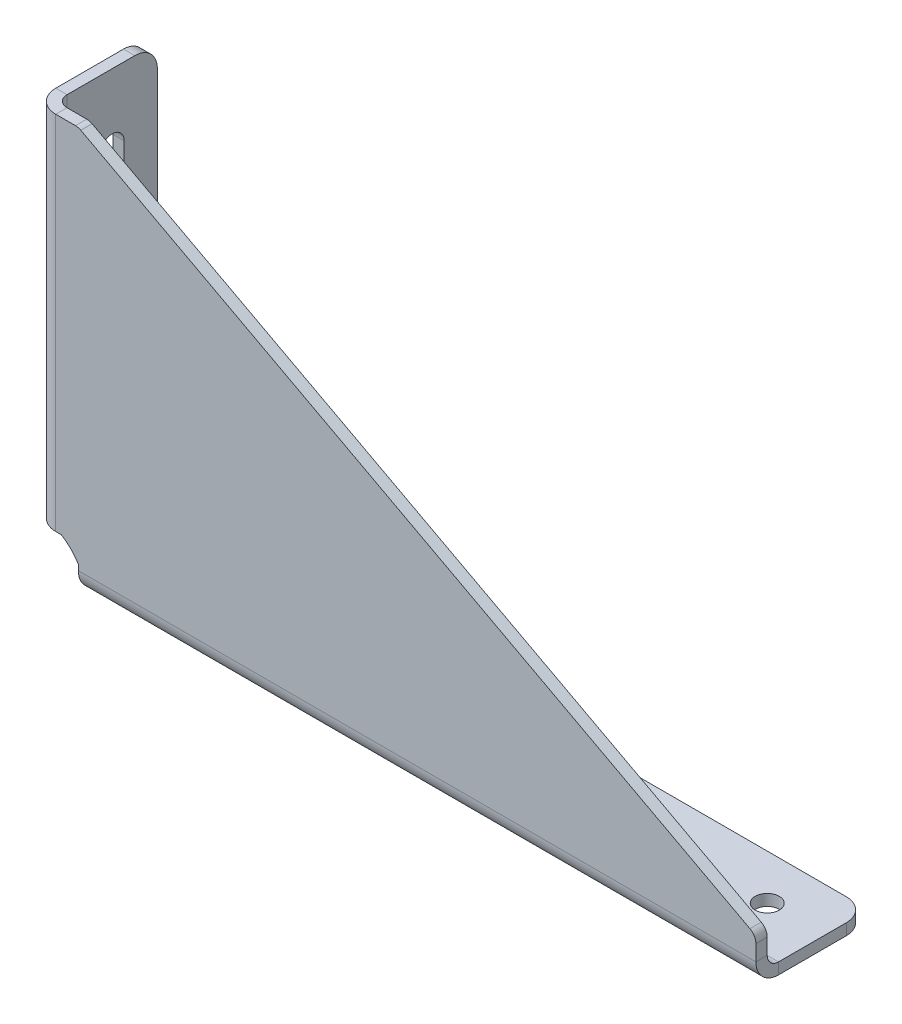
from build123d import *

# Parameters (mm, degrees)
BASE_FLANGE1_DEPTH                = 3.175
EDGE_FLANGE2_STRIP_W              = 19.05
EDGE_FLANGE2_STRIP_H              = 3.175
EDGE_FLANGE2_STRIP_CUT_DEPTH      = 190.5
EDGE_FLANGE2_RELIEF_W             = 20.6375
EDGE_FLANGE2_RELIEF_H             = 1.5875
EDGE_FLANGE2_RELIEF_CUT_DEPTH     = 3.175
EDGE_FLANGE2_STRIP_2_W            = 19.05
EDGE_FLANGE2_STRIP_2_H            = 3.175
EDGE_FLANGE2_STRIP_CUT_2_DEPTH    = 101.6
EDGE_FLANGE2_RELIEF_2_W           = 20.6375
EDGE_FLANGE2_RELIEF_2_H           = 1.5875
EDGE_FLANGE2_RELIEF_CUT_2_DEPTH   = 3.175
EDGE_FLANGE2_DEPTH                = 190.5
EDGE_FLANGE2_BEND_DEPTH           = 101.6
F_1_4_CLEARANCE_HOLE1_D           = 6.7564
F_1_4_CLEARANCE_HOLE1_ON_FACE_2_D = 6.7564
CUT_EXTRUDE1_DEPTH                = 235.885633075
FILLET1_R                         = 3.175
FILLET2_R                         = 6.35
F_1_4_START                       = -1
F_1_4_CLEARANCE_SLOT1_DEPTH       = 5
BODY_MOVE_COPY1_OUTLINE_R         = 3.3782
BODY_MOVE_COPY1_DEPTH             = 203.2
BODY_MOVE_COPY1_START             = 12.7
BODY_MOVE_COPY1_2_DEPTH           = 190.5
BODY_MOVE_COPY1_3_OUTLINE_R       = 3.3782
BODY_MOVE_COPY1_3_DEPTH           = 3.175
BODY_MOVE_COPY1_START_2           = 3.175
BODY_MOVE_COPY1_4_OUTLINE_W       = 101.6
BODY_MOVE_COPY1_4_OUTLINE_H       = 6.35
BODY_MOVE_COPY1_4_DEPTH           = 9.525
BODY_MOVE_COPY1_START_3           = 7.9375
BODY_MOVE_COPY1_5_DEPTH           = 4.7625
BODY_MOVE_COPY1_START_4           = 6.35
BODY_MOVE_COPY1_6_DEPTH           = 107.95
BODY_MOVE_COPY1_7_OUTLINE_W       = 4.7625
BODY_MOVE_COPY1_7_OUTLINE_H       = 6.35
BODY_MOVE_COPY1_7_OUTLINE_R       = 3.3782
BODY_MOVE_COPY1_7_DEPTH           = 7.9375
BODY_MOVE_COPY1_8_DEPTH           = 3.175
BODY_MOVE_COPY1_START_5           = -1
BODY_MOVE_COPY1_9_DEPTH           = 7.35
BODY_MOVE_COPY1_10_DEPTH          = 190.5


with BuildPart() as part:
    # Base-Flange1: sheet metal written as solids
    # Sketch3 → Base-Flange1 (new body)
    with BuildSketch(Plane.XY):
        with BuildLine():
            Line((0, 12.7), (0, 114.3))
            Line((0, 114.3), (12.7, 114.3))
            Line((12.7, 114.3), (203.2, 12.7))
            Line((203.2, 12.7), (203.2, 0))
            Line((203.2, 0), (12.7, 0))
            ThreePointArc((12.7, 0), (8.980256121, 8.980256121), (0, 12.7))
        make_face()
    extrude(amount=-BASE_FLANGE1_DEPTH)

    # Edge-Flange2: sheet metal written as solids
    # Edge-Flange2 strip (on a plane across the edge) → Edge-Flange2 strip cut (cut)
    with BuildSketch(Plane.YZ.offset(12.7)):
        with Locations((-3.175, -1.5875)):
            Rectangle(EDGE_FLANGE2_STRIP_W, EDGE_FLANGE2_STRIP_H)
    extrude(amount=EDGE_FLANGE2_STRIP_CUT_DEPTH, mode=Mode.SUBTRACT)

    # Edge-Flange2 relief (on the sheet) → Edge-Flange2 relief cut (cut)
    with BuildSketch(Plane(origin=(12.7, 6.35, 0), x_dir=(0, 1, 0), z_dir=(0, 0, 1))):
        with Locations((-8.73125, 0.79375)):
            Rectangle(EDGE_FLANGE2_RELIEF_W, EDGE_FLANGE2_RELIEF_H)
    extrude(amount=-EDGE_FLANGE2_RELIEF_CUT_DEPTH, mode=Mode.SUBTRACT)

    # Edge-Flange2 strip 2 (on a plane across the edge) → Edge-Flange2 strip cut 2 (cut)
    with BuildSketch(Plane.XZ.offset(-114.3)):
        with Locations((-3.175, -1.5875)):
            Rectangle(EDGE_FLANGE2_STRIP_2_W, EDGE_FLANGE2_STRIP_2_H)
    extrude(amount=EDGE_FLANGE2_STRIP_CUT_2_DEPTH, mode=Mode.SUBTRACT)

    # Edge-Flange2 relief 2 (on the sheet) → Edge-Flange2 relief cut 2 (cut)
    with BuildSketch(Plane(origin=(6.35, 114.3, 0), x_dir=(1, 0, 0), z_dir=(0, 0, 1))):
        with Locations((-8.73125, -102.39375)):
            Rectangle(EDGE_FLANGE2_RELIEF_2_W, EDGE_FLANGE2_RELIEF_2_H)
    extrude(amount=-EDGE_FLANGE2_RELIEF_CUT_2_DEPTH, mode=Mode.SUBTRACT)

    # Edge-Flange2 section (on a plane across the edge) → Edge-Flange2 (add)
    with BuildSketch(Plane.YZ.offset(12.7)):
        with BuildLine():
            Line((0, 3.175), (0, 28.575))
            Line((0, 28.575), (3.175, 28.575))
            Line((3.175, 28.575), (3.175, 3.175))
            ThreePointArc((3.175, 3.175), (4.10493597, 0.92993597), (6.35, 0))
            Line((6.35, 0), (6.35, -3.175))
            ThreePointArc((6.35, -3.175), (1.859871939, -1.315128061), (0, 3.175))
        make_face()
    extrude(amount=EDGE_FLANGE2_DEPTH)

    # Edge-Flange2 section 2 (on a plane across the edge) → Edge-Flange2 bend (add)
    with BuildSketch(Plane.XZ.offset(-114.3)):
        with BuildLine():
            Line((0, 3.175), (0, 28.575))
            Line((0, 28.575), (3.175, 28.575))
            Line((3.175, 28.575), (3.175, 3.175))
            ThreePointArc((3.175, 3.175), (4.10493597, 0.92993597), (6.35, 0))
            Line((6.35, 0), (6.35, -3.175))
            ThreePointArc((6.35, -3.175), (1.859871939, -1.315128061), (0, 3.175))
        make_face()
    extrude(amount=EDGE_FLANGE2_BEND_DEPTH)

    # 1/4 Clearance Hole1 (through all)
    with Locations(Plane(origin=(3.175, 28.575, 15.875), x_dir=(0, 0, 1), z_dir=(1, 0, 0))):
        with Locations((0, 0), (0, -63.5)):
            Hole(F_1_4_CLEARANCE_HOLE1_D / 2)

    # 1/4 Clearance Hole1 on face 2 (through all)
    with Locations(Plane(origin=(28.575, 3.175, 15.875), x_dir=(0, 0, 1), z_dir=(0, 1, 0))):
        with Locations((0, 0), (0, 158.75)):
            Hole(F_1_4_CLEARANCE_HOLE1_ON_FACE_2_D / 2)

    # Sketch27 → Cut-Extrude1 (cut, through all)
    with BuildSketch(Plane.XY):
        with BuildLine():
            Line((7.9375, 12.7), (0, 12.7))
            Line((0, 12.7), (0, 0))
            Line((0, 0), (12.7, 0))
            Line((12.7, 0), (12.7, 7.9375))
            ThreePointArc((12.7, 7.9375), (10.589945851, 10.589945851), (7.9375, 12.7))
        make_face()
    extrude(amount=-CUT_EXTRUDE1_DEPTH, mode=Mode.SUBTRACT)

    # Fillet1
    fillet1_edges = [part.edges().sort_by_distance(p)[0] for p in [
        (12.7, 114.3, -1.5875),
        (203.2, 12.7, -1.5875),
    ]]
    fillet(fillet1_edges, radius=FILLET1_R)

    # Fillet2
    fillet2_edges = [part.edges().sort_by_distance(p)[0] for p in [
        (12.7, 1.5875, 28.575),
        (203.2, 1.5875, 28.575),
        (1.5875, 114.3, 28.575),
        (1.5875, 12.7, 28.575),
    ]]
    fillet(fillet2_edges, radius=FILLET2_R)

    # 1/4 Clearance Slot1: read off the stored shape, not the designer's step
    # 1/4 Clearance Slot1 outline → 1/4 Clearance Slot1 (cut)
    with BuildSketch(Plane.YZ.offset(F_1_4_START)):
        with BuildLine():
            ThreePointArc((95.0468, 12.4968), (98.425, 15.875), (95.0468, 19.2532))
            Line((95.0468, 19.2532), (92.075, 19.2532))
            ThreePointArc((92.075, 19.2532), (95.4532, 15.875), (92.075, 12.4968))
            Line((92.075, 12.4968), (95.0468, 12.4968))
        make_face()
        with BuildLine():
            ThreePointArc((92.075, 12.4968), (88.6968, 15.875), (92.075, 19.2532))
            Line((92.075, 19.2532), (89.1032, 19.2532))
            ThreePointArc((89.1032, 19.2532), (85.725, 15.875), (89.1032, 12.4968))
            Line((89.1032, 12.4968), (92.075, 12.4968))
        make_face()
    extrude(amount=F_1_4_CLEARANCE_SLOT1_DEPTH, mode=Mode.SUBTRACT)

    # Body-Move/Copy1: read off the stored shape, not the designer's step
    # Body-Move/Copy1 outline → Body-Move/Copy1 (cut)
    # profile 1 of 2: a face of its own
    with BuildSketch(Plane.YZ):
        with BuildLine():
            Line((12.7, 3.175), (114.3, 3.175))
            Line((114.3, 3.175), (114.3, 22.225))
            ThreePointArc((114.3, 22.225), (112.440128061, 26.715128061), (107.95, 28.575))
            Line((107.95, 28.575), (19.05, 28.575))
            ThreePointArc((19.05, 28.575), (14.559871939, 26.715128061), (12.7, 22.225))
            Line((12.7, 22.225), (12.7, 3.175))
        make_face()
        with Locations((28.575, 15.875)):
            Circle(BODY_MOVE_COPY1_OUTLINE_R, mode=Mode.SUBTRACT)
        with BuildLine():
            Line((89.1032, 19.2532), (95.0468, 19.2532))
            ThreePointArc((95.0468, 19.2532), (98.425, 15.875), (95.0468, 12.4968))
            Line((95.0468, 12.4968), (89.1032, 12.4968))
            ThreePointArc((89.1032, 12.4968), (85.725, 15.875), (89.1032, 19.2532))
        make_face(mode=Mode.SUBTRACT)
    # profile 2 of 2: a face of its own
    with BuildSketch(Plane.YZ):
        with BuildLine():
            ThreePointArc((0.850738685, 0), (1.90100414, 1.355886872), (3.275819469, 2.381250001))
            ThreePointArc((3.275819469, 2.381250001), (3.200305714, 2.774936372), (3.175, 3.175))
            Line((3.175, 3.175), (3.175, 28.575))
            Line((3.175, 28.575), (0, 28.575))
            Line((0, 28.575), (0, 3.175))
            ThreePointArc((0, 3.175), (0.216371003, 1.531499064), (0.850738685, 0))
        make_face()
    extrude(amount=BODY_MOVE_COPY1_DEPTH, mode=Mode.SUBTRACT)

    # Body-Move_Copy1 2 outline → Body-Move_Copy1 2 (add)
    with BuildSketch(Plane.YZ.offset(BODY_MOVE_COPY1_START)):
        with BuildLine():
            Line((114.3, 3.175), (6.35, 3.175))
            ThreePointArc((6.35, 3.175), (4.7625, 2.973361062), (3.275819469, 2.381250001))
            ThreePointArc((3.275819469, 2.381250001), (4.405717517, 0.664942108), (6.35, 0))
            ThreePointArc((6.35, 0), (4.405717517, -0.664942108), (3.275819469, -2.381250001))
            ThreePointArc((3.275819469, -2.381250001), (4.7625, -2.973361062), (6.35, -3.175))
            Line((6.35, -3.175), (114.3, -3.175))
            Line((114.3, -3.175), (114.3, 3.175))
        make_face()
        with BuildLine():
            ThreePointArc((3.275819469, -2.381250001), (1.90100414, -1.355886872), (0.850738685, 0))
            ThreePointArc((0.850738685, 0), (0.216371003, -1.531499064), (0, -3.175))
            Line((0, -3.175), (0, -28.575))
            Line((0, -28.575), (3.175, -28.575))
            Line((3.175, -28.575), (3.175, -3.175))
            ThreePointArc((3.175, -3.175), (3.200305714, -2.774936372), (3.275819469, -2.381250001))
        make_face()
    extrude(amount=BODY_MOVE_COPY1_2_DEPTH)

    # Body-Move_Copy1 3 outline → Body-Move_Copy1 3 (add)
    with BuildSketch(Plane.YZ):
        with BuildLine():
            Line((114.3, 3.175), (12.7, 3.175))
            Line((12.7, 3.175), (12.7, -22.225))
            ThreePointArc((12.7, -22.225), (14.559871939, -26.715128061), (19.05, -28.575))
            Line((19.05, -28.575), (107.95, -28.575))
            ThreePointArc((107.95, -28.575), (112.440128061, -26.715128061), (114.3, -22.225))
            Line((114.3, -22.225), (114.3, 3.175))
        make_face()
        with BuildLine():
            ThreePointArc((89.1032, -19.2532), (85.725, -15.875), (89.1032, -12.4968))
            Line((89.1032, -12.4968), (95.0468, -12.4968))
            ThreePointArc((95.0468, -12.4968), (98.425, -15.875), (95.0468, -19.2532))
            Line((95.0468, -19.2532), (89.1032, -19.2532))
        make_face(mode=Mode.SUBTRACT)
        with Locations((28.575, -15.875)):
            Circle(BODY_MOVE_COPY1_3_OUTLINE_R, mode=Mode.SUBTRACT)
    extrude(amount=BODY_MOVE_COPY1_3_DEPTH)

    # Body-Move_Copy1 4 outline → Body-Move_Copy1 4 (add)
    with BuildSketch(Plane.YZ.offset(BODY_MOVE_COPY1_START_2)):
        with Locations((63.5, 0)):
            Rectangle(BODY_MOVE_COPY1_4_OUTLINE_W, BODY_MOVE_COPY1_4_OUTLINE_H)
    extrude(amount=BODY_MOVE_COPY1_4_DEPTH)

    # Body-Move_Copy1 5 outline → Body-Move_Copy1 5 (add)
    with BuildSketch(Plane.YZ.offset(BODY_MOVE_COPY1_START_3)):
        with BuildLine():
            Line((12.7, -3.175), (12.7, 3.175))
            Line((12.7, 3.175), (6.35, 3.175))
            ThreePointArc((6.35, 3.175), (4.7625, 2.973361062), (3.275819469, 2.381250001))
            ThreePointArc((3.275819469, 2.381250001), (4.405717517, 0.664942108), (6.35, 0))
            ThreePointArc((6.35, 0), (4.405717517, -0.664942108), (3.275819469, -2.381250001))
            ThreePointArc((3.275819469, -2.381250001), (4.7625, -2.973361062), (6.35, -3.175))
            Line((6.35, -3.175), (12.7, -3.175))
        make_face()
    extrude(amount=BODY_MOVE_COPY1_5_DEPTH)

    # Body-Move_Copy1 6 outline → Body-Move_Copy1 6 (cut)
    with BuildSketch(Plane(origin=(0, 0, 0), x_dir=(1, 0, 0), z_dir=(0, 1, 0)).offset(BODY_MOVE_COPY1_START_4)):
        with BuildLine():
            Line((203.2, 3.175), (3.175, 3.175))
            ThreePointArc((3.175, 3.175), (4.10493597, 0.92993597), (6.35, 0))
            Line((6.35, 0), (203.2, 0))
            Line((203.2, 0), (203.2, 3.175))
        make_face()
        with BuildLine():
            Line((0, -3.175), (6.35, -3.175))
            ThreePointArc((6.35, -3.175), (1.859871939, -1.315128061), (0, 3.175))
            Line((0, 3.175), (0, -3.175))
        make_face()
    extrude(amount=BODY_MOVE_COPY1_6_DEPTH, mode=Mode.SUBTRACT)

    # Body-Move_Copy1 7 outline → Body-Move_Copy1 7 (cut)
    with BuildSketch(Plane(origin=(0, 0, 0), x_dir=(1, 0, 0), z_dir=(0, 1, 0))):
        with Locations((10.31875, 0)):
            Rectangle(BODY_MOVE_COPY1_7_OUTLINE_W, BODY_MOVE_COPY1_7_OUTLINE_H)
        with Locations((187.325, 15.875)):
            Circle(BODY_MOVE_COPY1_7_OUTLINE_R)
        with Locations((28.575, 15.875)):
            Circle(BODY_MOVE_COPY1_7_OUTLINE_R)
    extrude(amount=BODY_MOVE_COPY1_7_DEPTH, mode=Mode.SUBTRACT)

    # Body-Move_Copy1 8 outline → Body-Move_Copy1 8 (cut)
    with BuildSketch(Plane.XY):
        with BuildLine():
            Line((13.400367647, 113.926470588), (201.519117647, 13.596470588))
            ThreePointArc((201.519117647, 13.596470588), (202.747540039, 12.428524023), (203.2, 10.795))
            Line((203.2, 10.795), (203.2, 114.3))
            Line((203.2, 114.3), (11.90625, 114.3))
            ThreePointArc((11.90625, 114.3), (12.676300609, 114.205202438), (13.400367647, 113.926470588))
        make_face()
        with BuildLine():
            Line((7.9375, 7.9375), (12.7, 7.9375))
            ThreePointArc((12.7, 7.9375), (10.589945851, 10.589945851), (7.9375, 12.7))
            Line((7.9375, 12.7), (7.9375, 7.9375))
        make_face()
    extrude(amount=BODY_MOVE_COPY1_8_DEPTH, mode=Mode.SUBTRACT)

    # Body-Move_Copy1 9 outline → Body-Move_Copy1 9 (cut)
    with BuildSketch(Plane(origin=(0, 0, 0), x_dir=(1, 0, 0), z_dir=(0, 1, 0)).offset(BODY_MOVE_COPY1_START_5)):
        with BuildLine():
            ThreePointArc((196.85, 28.575), (201.340128061, 26.715128061), (203.2, 22.225))
            Line((203.2, 22.225), (203.2, 28.575))
            Line((203.2, 28.575), (196.85, 28.575))
        make_face()
        with BuildLine():
            ThreePointArc((12.7, 22.225), (14.559871939, 26.715128061), (19.05, 28.575))
            Line((19.05, 28.575), (12.7, 28.575))
            Line((12.7, 28.575), (12.7, 22.225))
        make_face()
    extrude(amount=BODY_MOVE_COPY1_9_DEPTH, mode=Mode.SUBTRACT)

    # Body-Move_Copy1 10 outline → Body-Move_Copy1 10 (cut)
    with BuildSketch(Plane.YZ.offset(BODY_MOVE_COPY1_START)):
        with BuildLine():
            ThreePointArc((6.35, 0), (4.405717517, -0.664942108), (3.275819469, -2.381250001))
            ThreePointArc((3.275819469, -2.381250001), (4.7625, -2.973361062), (6.35, -3.175))
            Line((6.35, -3.175), (6.35, 0))
        make_face()
    extrude(amount=BODY_MOVE_COPY1_10_DEPTH, mode=Mode.SUBTRACT)


solid = part.part
